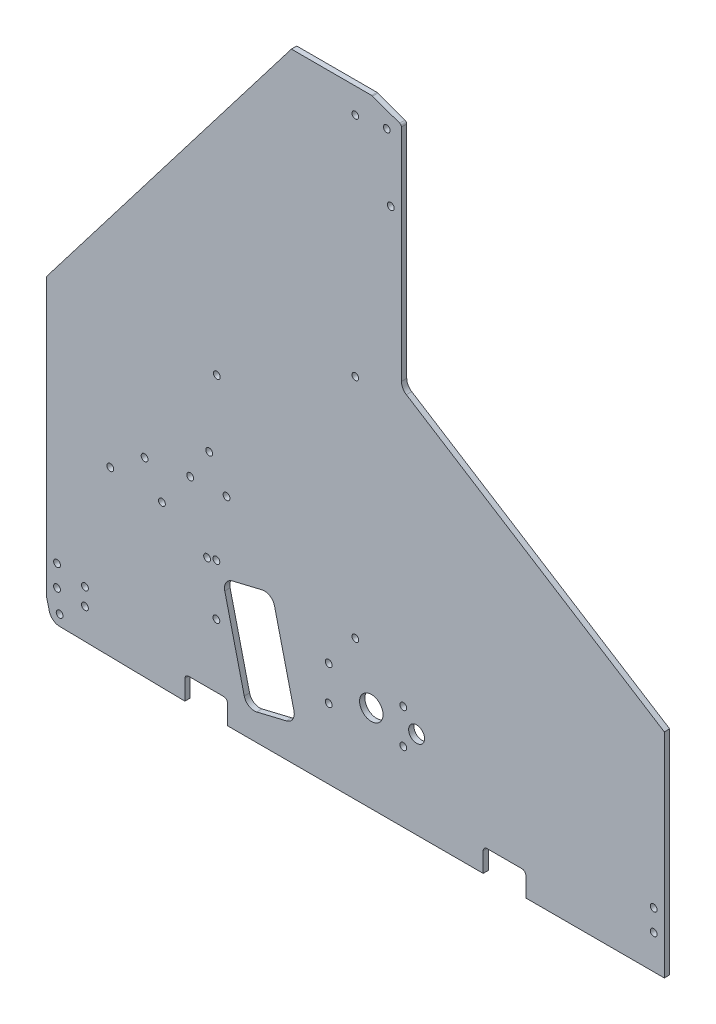
from build123d import *

# Parameters (mm, degrees)
SKETCH1_R           = 2.032
SKETCH1_R_2         = 2
BOSS_EXTRUDE1_DEPTH = 3.175
FILLET1_R           = 2.286
FILLET2_R           = 6.35
SKETCH2_R           = 2.032
CUT_EXTRUDE1_DEPTH  = 507.700158896
FILLET3_R           = 1.5875
CUT_EXTRUDE2_DEPTH  = 507.700158896
SKETCH4_R           = 2.032
SKETCH4_R_2         = 6.985
SKETCH4_R_3         = 4.7625
CUT_EXTRUDE3_DEPTH  = 507.700158896


with BuildPart() as part:
    # Sketch1 → Boss-Extrude1 (new body)
    with BuildSketch(Plane.XY):
        with BuildLine():
            Line((7.829508682, -19.049081656), (82.55, -20.32))
            Line((82.55, -20.32), (82.55, -6.35))
            Line((82.55, -6.35), (107.95, -6.35))
            Line((107.95, -6.35), (107.95, -20.32))
            Line((107.95, -20.32), (260.35, -20.32))
            Line((260.35, -20.32), (260.35, -6.35))
            Line((260.35, -6.35), (285.75, -6.35))
            Line((285.75, -6.35), (285.75, -20.32))
            Line((285.75, -20.32), (368.3, -20.32))
            Line((368.3, -20.32), (368.3, 106.68))
            Line((368.3, 106.68), (211.61375, 205.74))
            Line((211.61375, 205.74), (211.61375, 341.63))
            Line((211.61375, 341.63), (194.14998, 347.98))
            Line((194.14998, 347.98), (184.15, 347.98))
            Line((184.15, 347.98), (146.05, 347.98))
            Line((146.05, 347.98), (0, 157.48))
            Line((0, 157.48), (0, 0))
            Line((0, 0), (0, -6.35))
            ThreePointArc((0, -6.35), (0.047577015, -7.125863724), (0.189595124, -7.890101219))
            Line((0.189595124, -7.890101219), (1.777095124, -14.240101219))
            ThreePointArc((1.777095124, -14.240101219), (3.987212552, -17.671692778), (7.829508682, -19.049081656))
        make_face()
        with Locations((7.9375, -12.7)):
            Circle(SKETCH1_R, mode=Mode.SUBTRACT)
        with Locations((6.35, 0)):
            Circle(SKETCH1_R, mode=Mode.SUBTRACT)
        with Locations((6.35, 12.7)):
            Circle(SKETCH1_R, mode=Mode.SUBTRACT)
        with Locations((95.797306087, 60.410494967)):
            Circle(SKETCH1_R, mode=Mode.SUBTRACT)
        with Locations((184.15, 62.98)):
            Circle(SKETCH1_R_2, mode=Mode.SUBTRACT)
        with Locations((38.1, 78.105)):
            Circle(SKETCH1_R, mode=Mode.SUBTRACT)
        with Locations((68.887329744, 75.518700365)):
            Circle(SKETCH1_R, mode=Mode.SUBTRACT)
        with Locations((58.568579744, 93.391299635)):
            Circle(SKETCH1_R, mode=Mode.SUBTRACT)
        with Locations((85.725, 97.155)):
            Circle(SKETCH1_R, mode=Mode.SUBTRACT)
        with Locations((107.382158942, 97.743700365)):
            Circle(SKETCH1_R, mode=Mode.SUBTRACT)
        with Locations((97.063408942, 115.616299635)):
            Circle(SKETCH1_R, mode=Mode.SUBTRACT)
        with Locations((101.6, 157.48)):
            Circle(SKETCH1_R, mode=Mode.SUBTRACT)
        with Locations((361.95, 0)):
            Circle(SKETCH1_R, mode=Mode.SUBTRACT)
        with Locations((361.95, 12.7)):
            Circle(SKETCH1_R, mode=Mode.SUBTRACT)
        with Locations((184.15, 197.98)):
            Circle(SKETCH1_R_2, mode=Mode.SUBTRACT)
        with Locations((184.15, 332.98)):
            Circle(SKETCH1_R_2, mode=Mode.SUBTRACT)
        with Locations((205.26375, 296.418)):
            Circle(SKETCH1_R, mode=Mode.SUBTRACT)
        with Locations((202.881865, 335.28)):
            Circle(SKETCH1_R_2, mode=Mode.SUBTRACT)
    extrude(amount=BOSS_EXTRUDE1_DEPTH)

    # Fillet1
    fillet1_edges = [part.edges().sort_by_distance(p)[0] for p in [
        (285.75, -6.35, 1.5875),
        (107.95, -6.35, 1.5875),
        (260.35, -6.35, 1.5875),
        (82.55, -6.35, 1.5875),
    ]]
    fillet(fillet1_edges, radius=FILLET1_R)

    # Fillet2
    fillet2_edges = [part.edges().sort_by_distance(p)[0] for p in [
        (211.61375, 205.74, 1.5875),
    ]]
    fillet(fillet2_edges, radius=FILLET2_R)

    # Sketch2 → Cut-Extrude1 (cut, through all)
    with BuildSketch(Plane(origin=(0, 0, 0), x_dir=(-1, 0, 0), z_dir=(0, 0, -1))):
        with Locations((-101.339768613, 61.847479268)):
            Circle(SKETCH2_R)
        with Locations((-101.339768613, 31.367479268)):
            Circle(SKETCH2_R)
        with Locations((-23.011998341, 8.96398506)):
            Circle(SKETCH2_R)
        with Locations((-23.011998341, -1.19601494)):
            Circle(SKETCH2_R)
    extrude(amount=-CUT_EXTRUDE1_DEPTH, mode=Mode.SUBTRACT)

    # Fillet3
    fillet3_edges = [part.edges().sort_by_distance(p)[0] for p in [
        (211.61375, 341.63, 1.5875),
        (194.14998, 347.98, 1.5875),
    ]]
    fillet(fillet3_edges, radius=FILLET3_R)

    # Sketch3 → Cut-Extrude2 (cut, through all)
    with BuildSketch(Plane.XY.offset(3.175)):
        with BuildLine():
            Line((128.576348549, 60.121218076), (110.877748678, 55.878628939))
            ThreePointArc((110.877748678, 55.878628939), (107.074938194, 53.117732923), (106.338193408, 48.476491548))
            Line((106.338193408, 48.476491548), (117.947036213, 0.048454537))
            ThreePointArc((117.947036213, 0.048454537), (120.707932229, -3.754355947), (125.349173604, -4.491100733))
            Line((125.349173604, -4.491100733), (143.047773476, -0.248511595))
            ThreePointArc((143.047773476, -0.248511595), (146.850583959, 2.51238442), (147.587328745, 7.153625796))
            Line((147.587328745, 7.153625796), (135.97848594, 55.581662807))
            ThreePointArc((135.97848594, 55.581662807), (133.217589925, 59.38447329), (128.576348549, 60.121218076))
        make_face()
    extrude(amount=-CUT_EXTRUDE2_DEPTH, mode=Mode.SUBTRACT)

    # Sketch4 → Cut-Extrude3 (cut, through all)
    with BuildSketch(Plane.XY.offset(3.175)):
        with Locations((168.275, 42.06875)):
            Circle(SKETCH4_R)
        with Locations((212.725, 42.06875)):
            Circle(SKETCH4_R)
        with Locations((212.725, 21.43125)):
            Circle(SKETCH4_R)
        with Locations((168.275, 21.43125)):
            Circle(SKETCH4_R)
        with Locations((193.675, 31.75)):
            Circle(SKETCH4_R_2)
        with Locations((220.6625, 31.75)):
            Circle(SKETCH4_R_3)
    extrude(amount=-CUT_EXTRUDE3_DEPTH, mode=Mode.SUBTRACT)


solid = part.part
